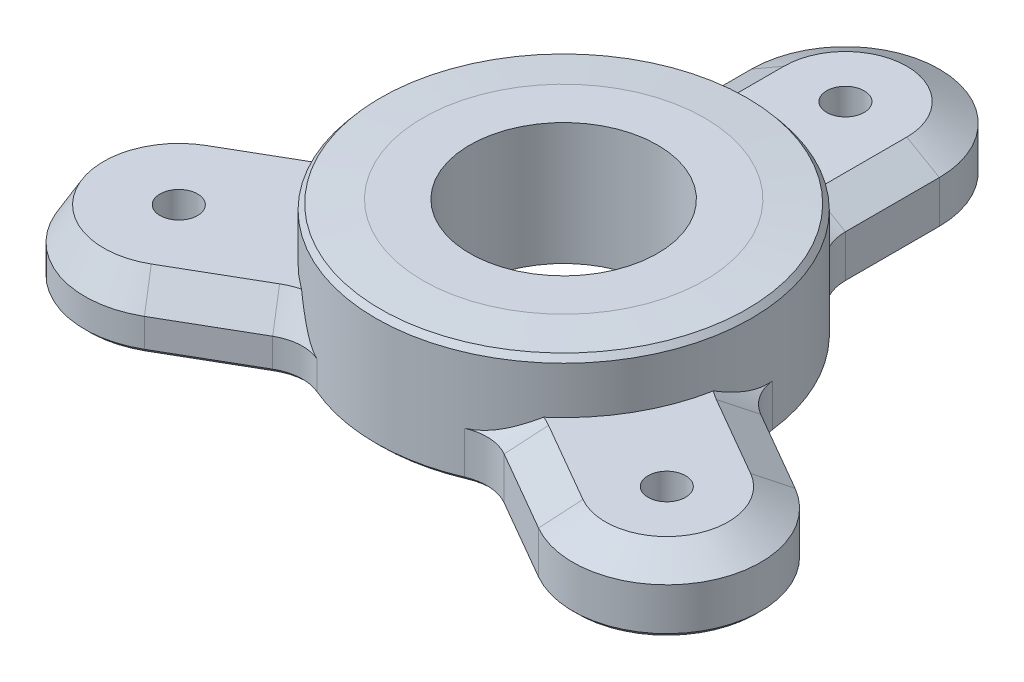
from build123d import *

# Parameters (mm, degrees)
SKETCH_2_R        = 2
EXTRUDE_1_DEPTH   = 7
EXTRUDE_1_2_DEPTH = 7
EXTRUDE_1_3_DEPTH = 7
SKETCH_3_R        = 20
SKETCH_3_R_2      = 10
EXTRUDE_2_DEPTH   = 13
FILLET_1_R        = 5
CHAMFER_1_SIZE    = 5
CHAMFER_1_SIZE2   = 0.437443318
CHAMFER_2_SIZE    = 3.464101615
CHAMFER_2_SIZE_2  = 2
CHAMFER_3_SIZE    = 0.5
CHAMFER_4_SIZE    = 0.5
CHAMFER_4_SIZE2   = 0.550031434


with BuildPart() as part:
    # ｽｹｯﾁ2 → ﾎﾞｽ - 押し出し1 (new body)
    with BuildSketch(Plane(origin=(0, 0, 0), x_dir=(1, 0, 0), z_dir=(0, 1, 0))):
        with BuildLine():
            Line((10, -17.320508076), (20.980762114, -23.660254038))
            ThreePointArc((20.980762114, -23.660254038), (34.641016151, -20), (30.980762114, -6.339745962))
            Line((30.980762114, -6.339745962), (20, 0))
            ThreePointArc((20, 0), (17.320508076, -10), (10, -17.320508076))
        make_face()
        with Locations(Location((25.980762114, -15, 0), (0, 0, 270))):
            Circle(SKETCH_2_R, mode=Mode.SUBTRACT)
    extrude(amount=EXTRUDE_1_DEPTH)



with BuildPart() as body_2:
    # ｽｹｯﾁ2 → Extrude 1 2 (new body)
    with BuildSketch(Plane(origin=(0, 0, 0), x_dir=(1, 0, 0), z_dir=(0, 1, 0))):
        with BuildLine():
            Line((-20.980762114, -23.660254038), (-10, -17.320508076))
            ThreePointArc((-10, -17.320508076), (-17.320508076, -10), (-20, 0))
            Line((-20, 0), (-30.980762114, -6.339745962))
            ThreePointArc((-30.980762114, -6.339745962), (-34.641016151, -20), (-20.980762114, -23.660254038))
        make_face()
        with Locations(Location((-25.980762114, -15, 0), (0, 0, 270))):
            Circle(SKETCH_2_R, mode=Mode.SUBTRACT)
    extrude(amount=EXTRUDE_1_2_DEPTH)


with BuildPart() as body_3:
    # ｽｹｯﾁ2 → Extrude 1 3 (new body)
    with BuildSketch(Plane(origin=(0, 0, 0), x_dir=(1, 0, 0), z_dir=(0, 1, 0))):
        with BuildLine():
            ThreePointArc((-10, 17.320508076), (0, 20), (10, 17.320508076))
            Line((10, 17.320508076), (10, 30))
            ThreePointArc((10, 30), (0, 40), (-10, 30))
            Line((-10, 30), (-10, 17.320508076))
        make_face()
        with Locations(Location((0, 30, 0), (0, 0, 270))):
            Circle(SKETCH_2_R, mode=Mode.SUBTRACT)
    extrude(amount=EXTRUDE_1_3_DEPTH)


with BuildPart() as part_1:
    add(part.part)

    add(body_2.part)  # ﾎﾞｽ - 押し出し2 merges body 2

    add(body_3.part)  # ﾎﾞｽ - 押し出し2 merges body 3
    # ｽｹｯﾁ3 → ﾎﾞｽ - 押し出し2 (add)
    with BuildSketch(Plane.XZ):
        with Locations(Location((0, 0, 0), (0, 0, 270))):
            Circle(SKETCH_3_R)
        with Locations(Location((0, 0, 0), (0, 0, 270))):
            Circle(SKETCH_3_R_2, mode=Mode.SUBTRACT)
    extrude(amount=-EXTRUDE_2_DEPTH)

    # ﾌｨﾚｯﾄ1
    fillet_1_edges = [part_1.edges().sort_by_distance(p)[0] for p in [
        (10, 3.5, 17.320508076),
        (20, 3.5, 0),
        (-10, 3.5, 17.320508076),
        (-20, 3.5, 0),
        (-10, 3.5, -17.320508076),
        (10, 3.5, -17.320508076),
    ]]
    fillet(fillet_1_edges, radius=FILLET_1_R)

    # 面取り1
    chamfer_1_edges = [part_1.edges().sort_by_distance(p)[0] for p in [
        (0, 13, 20),
    ]]
    chamfer_1_side = [part_1.faces().sort_by_distance(p)[0] for p in [
        (0, 13, 19.434314575),
    ]]
    chamfer(chamfer_1_edges, length=CHAMFER_1_SIZE, length2=CHAMFER_1_SIZE2, reference=chamfer_1_side[0])

    # 面取り2
    # the kernel refuses this chamfer: 3.464101615, 2 mm, written as the material it takes off along each edge
    with BuildSketch(Plane(origin=(12.320508076, 7, 18.660254038), x_dir=(0.4999066103111042, 0.01932676561270069, -0.8658636480983676), z_dir=(0.8660254037844386, 0, 0.5000000000000003)), Plane(origin=(10, 7, -20), x_dir=(-0.9998132206222079, 0.01932676561270069, 0), z_dir=(0, 0, -1)), Plane(origin=(-10, 7, -30), x_dir=(0.9998132206222079, 0.01932676561270069, 0), z_dir=(0, 0, 1)), Plane(origin=(30.980762114, 7, 6.339745962), x_dir=(-0.4999066103111044, 0.01932676561270069, 0.8658636480983674), z_dir=(-0.8660254037844385, 0, -0.5000000000000004))) as chamfer_2_piece_1:
        Polygon((CHAMFER_2_SIZE * 0.999813220662, -CHAMFER_2_SIZE * 0.0193267656135), (-CHAMFER_2_SIZE_2 * 0.0193267656127, -CHAMFER_2_SIZE_2 * 0.999813220622), (0, 0), align=None)
    extrude(amount=10, mode=Mode.SUBTRACT)
    with BuildSketch(Plane(origin=(-25.980762114, 7, 15), x_dir=(-0.5000000000000021, 0, -0.8660254037844373), z_dir=(0.8660254037844373, 0, -0.5000000000000021))) as chamfer_2_piece_2:
        Polygon((10 - CHAMFER_2_SIZE_2, 0), (10, -CHAMFER_2_SIZE), (10, 0), align=None)
    revolve(axis=Axis((-25.980762114, 7, 15), (0, 1, 0)), revolution_arc=180, mode=Mode.SUBTRACT)
    with BuildSketch(Plane(origin=(-22.320508076, 7, 1.339745962), x_dir=(0.49916137187689635, 0.05789386240267152, 0.8645728572665669), z_dir=(-0.8660254037844386, 0, 0.5000000000000001)), Plane(origin=(-20.980762114, 7, 23.660254038), x_dir=(-0.4991613718768962, 0.057893862402671505, -0.8645728572665671), z_dir=(0.8660254037844387, 0, -0.49999999999999983))) as chamfer_2_piece_3:
        Polygon((CHAMFER_2_SIZE_2 * 0.998322743754, -CHAMFER_2_SIZE_2 * 0.0578938624027), (-CHAMFER_2_SIZE * 0.057893862405, -CHAMFER_2_SIZE * 0.998322743793), (0, 0), align=None)
    extrude(amount=10, mode=Mode.SUBTRACT)
    with BuildSketch(Plane(origin=(-24.820508076, 7, -2.990381057), x_dir=(-0.10176135112534013, 0, -0.9948088396356083), z_dir=(-0.9948088396356083, 0, 0.10176135112534013))) as chamfer_2_piece_4_section:
        Polygon((5, CHAMFER_2_SIZE), (5 + CHAMFER_2_SIZE_2, 0), (5, 0), align=None)
    chamfer_2_piece_4 = revolve(axis=Axis((-24.820508076, 7, -2.990381057), (0, -1, 0)), revolution_arc=155.840605946, mode=Mode.PRIVATE)
    chamfer_2_piece_4 = chamfer_2_piece_4 - Plane(origin=(0, 5.431561908, 0), x_dir=(0, 0, -1), z_dir=(0, -1, 0)) * Cylinder(20, 28, mode=Mode.PRIVATE)
    add(chamfer_2_piece_4, mode=Mode.SUBTRACT)
    with BuildSketch(Plane(origin=(-9.820508076, 7, 22.990381057), x_dir=(0.8106490514710499, 0, 0.5855323350158272), z_dir=(-0.5855323350158272, 0, 0.8106490514710499))) as chamfer_2_piece_5_section:
        Polygon((5 + CHAMFER_2_SIZE_2, 0), (5, -CHAMFER_2_SIZE), (5, 0), align=None)
    chamfer_2_piece_5 = revolve(axis=Axis((-9.820508076, 7, 22.990381057), (0, 1, 0)), revolution_arc=155.840605946, mode=Mode.PRIVATE)
    chamfer_2_piece_5 = chamfer_2_piece_5 - Plane(origin=(0, 5.431562064, 0), x_dir=(0, 0, -1), z_dir=(0, -1, 0)) * Cylinder(20, 29, mode=Mode.PRIVATE)
    add(chamfer_2_piece_5, mode=Mode.SUBTRACT)
    with BuildSketch(Plane(origin=(0, 7, -30), x_dir=(1, 0, 0), z_dir=(0, 0, 1))) as chamfer_2_piece_6:
        Polygon((10 - CHAMFER_2_SIZE, 0), (10, -CHAMFER_2_SIZE_2), (10, 0), align=None)
    revolve(axis=Axis((0, 7, -30), (0, 1, 0)), revolution_arc=180, mode=Mode.SUBTRACT)
    with BuildSketch(Plane(origin=(25.980762114, 7, 15), x_dir=(-0.4999999999999975, 0, 0.8660254037844399), z_dir=(-0.8660254037844399, 0, -0.4999999999999975))) as chamfer_2_piece_7:
        Polygon((10 - CHAMFER_2_SIZE, 0), (10, -CHAMFER_2_SIZE_2), (10, 0), align=None)
    revolve(axis=Axis((25.980762114, 7, 15), (0, 1, 0)), revolution_arc=180, mode=Mode.SUBTRACT)
    with BuildSketch(Plane(origin=(-15, 7, -20), x_dir=(-0.9124104025964815, 0, 0.40927650461970855), z_dir=(-0.40927650461970855, 0, -0.9124104025964815))) as chamfer_2_piece_8_section:
        Polygon((5 + CHAMFER_2_SIZE, 0), (5, -CHAMFER_2_SIZE_2), (5, 0), align=None)
    chamfer_2_piece_8 = revolve(axis=Axis((-15, 7, -20), (0, 1, 0)), revolution_arc=155.840605946, mode=Mode.PRIVATE)
    chamfer_2_piece_8 = chamfer_2_piece_8 - Plane(origin=(0, 6.05627025, 0), x_dir=(0, 0, -1), z_dir=(0, -1, 0)) * Cylinder(20, 34, mode=Mode.PRIVATE)
    add(chamfer_2_piece_8, mode=Mode.SUBTRACT)
    with BuildSketch(Plane(origin=(9.820508076, 7, 22.990381057), x_dir=(-0.8106490514711084, 0, 0.5855323350157463), z_dir=(0.5855323350157463, 0, 0.8106490514711084))) as chamfer_2_piece_9_section:
        Polygon((5 + CHAMFER_2_SIZE, 0), (5, CHAMFER_2_SIZE_2), (5, 0), align=None)
    chamfer_2_piece_9 = revolve(axis=Axis((9.820508076, 7, 22.990381057), (0, -1, 0)), revolution_arc=155.840605946, mode=Mode.PRIVATE)
    chamfer_2_piece_9 = chamfer_2_piece_9 - Plane(origin=(0, 6.056270332, 0), x_dir=(0, 0, -1), z_dir=(0, -1, 0)) * Cylinder(20, 34, mode=Mode.PRIVATE)
    add(chamfer_2_piece_9, mode=Mode.SUBTRACT)
    with BuildSketch(Plane(origin=(24.820508076, 7, -2.990381057), x_dir=(0.1017613511254389, 0, -0.9948088396355981), z_dir=(0.9948088396355981, 0, 0.1017613511254389))) as chamfer_2_piece_10_section:
        Polygon((5, -CHAMFER_2_SIZE_2), (5 + CHAMFER_2_SIZE, 0), (5, 0), align=None)
    chamfer_2_piece_10 = revolve(axis=Axis((24.820508076, 7, -2.990381057), (0, 1, 0)), revolution_arc=155.840605946, mode=Mode.PRIVATE)
    chamfer_2_piece_10 = chamfer_2_piece_10 - Plane(origin=(0, 6.056270131, 0), x_dir=(0, 0, -1), z_dir=(0, -1, 0)) * Cylinder(20, 34, mode=Mode.PRIVATE)
    add(chamfer_2_piece_10, mode=Mode.SUBTRACT)
    with BuildSketch(Plane(origin=(15, 7, -20), x_dir=(0.9124104025963968, 0, 0.4092765046198976), z_dir=(0.4092765046198976, 0, -0.9124104025963968))) as chamfer_2_piece_11_section:
        Polygon((5 + CHAMFER_2_SIZE, 0), (5, CHAMFER_2_SIZE_2), (5, 0), align=None)
    chamfer_2_piece_11 = revolve(axis=Axis((15, 7, -20), (0, -1, 0)), revolution_arc=155.840605946, mode=Mode.PRIVATE)
    chamfer_2_piece_11 = chamfer_2_piece_11 - Plane(origin=(0, 6.056270339, 0), x_dir=(0, 0, -1), z_dir=(0, -1, 0)) * Cylinder(20, 34, mode=Mode.PRIVATE)
    add(chamfer_2_piece_11, mode=Mode.SUBTRACT)

    # 面取り3
    chamfer_3_edges = [part_1.edges().sort_by_distance(p)[0] for p in [
        (-16.650635095, 0, 21.160254038),
        (-34.641016151, 0, 20),
        (-26.650635095, 0, 3.839745962),
        (-10, 0, -25),
        (0, 0, -40),
        (10, 0, -25),
        (-17.320508076, 0, -10),
        (0, 0, 20),
        (17.320508076, 0, -10),
        (-10.527864045, 0, -17.763932023),
        (-20.647948425, 0, -0.235431699),
        (-10.12008438, 0, 17.999363722),
        (10.12008438, 0, 17.999363722),
        (20.647948425, 0, -0.235431699),
        (16.650635095, 0, 21.160254038),
        (10.527864045, 0, -17.763932022),
        (26.650635095, 0, 3.839745962),
        (34.641016151, 0, 20),
    ]]
    chamfer(chamfer_3_edges, length=CHAMFER_3_SIZE)

    # 面取り4
    chamfer_4_edges = [part_1.edges().sort_by_distance(p)[0] for p in [
        (0, 12.562556682, 20),
    ]]
    chamfer_4_side = [part_1.faces().sort_by_distance(p)[0] for p in [
        (0, 12.781278341, 17.5),
    ]]
    chamfer(chamfer_4_edges, length=CHAMFER_4_SIZE, length2=CHAMFER_4_SIZE2, reference=chamfer_4_side[0])


solid = part_1.part
